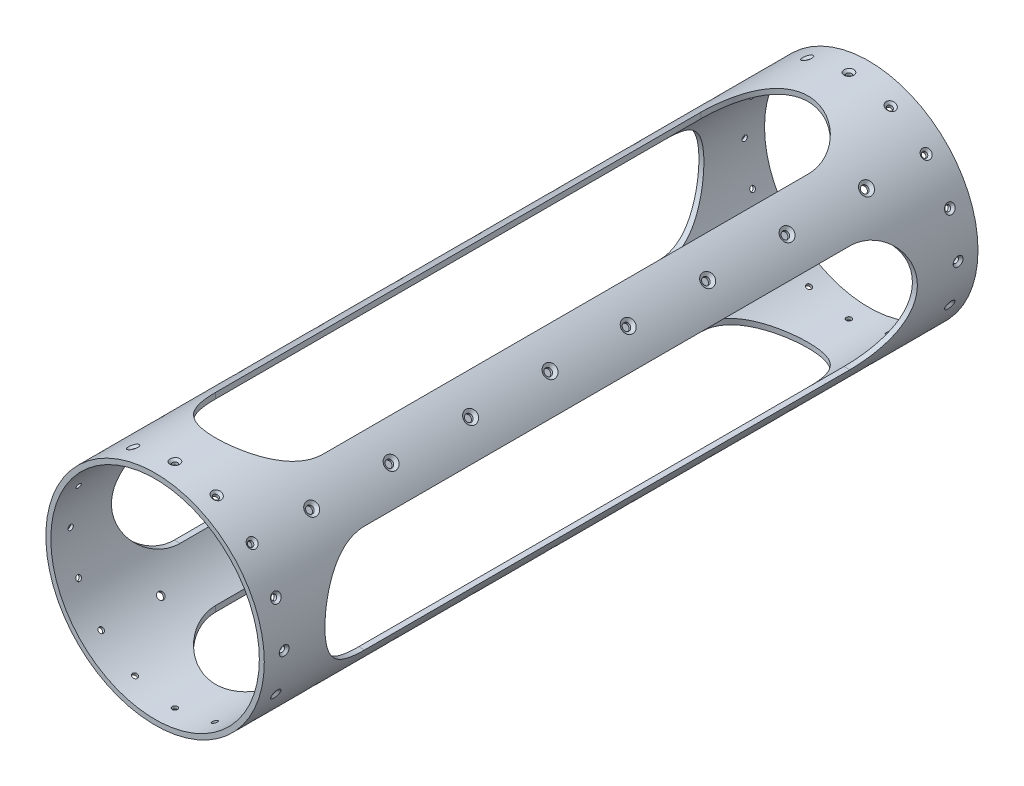
from build123d import *

# Parameters (mm, degrees)
SKETCH1_R                                         = 69.85
SKETCH1_R_2                                       = 66.675
EXTRUDE1_DEPTH                                    = 228.2063
CSK_FOR_M3_FLAT_HEAD_MACHINE_SCREW1_D             = 3.4
CSK_FOR_M3_FLAT_HEAD_MACHINE_SCREW1_CSINK_D       = 6.3
CSK_FOR_M3_FLAT_HEAD_MACHINE_SCREW1_CSINK_ANGLE   = 90
EXTRUDE2_DEPTH                                    = 249.668776557
CIRPATTERN2_COUNT                                 = 4
CIRPATTERN1_COUNT                                 = 16
CSK_FOR_8_FLAT_HEAD_MACHINE_SCREW_100_D           = 4.4958
CSK_FOR_8_FLAT_HEAD_MACHINE_SCREW_100_CSINK_D     = 8.4328
CSK_FOR_8_FLAT_HEAD_MACHINE_SCREW_100_CSINK_ANGLE = 100
LPATTERN1_COUNT                                   = 4
LPATTERN1_PITCH                                   = 50.8
CIRPATTERN3_COUNT                                 = 4
CIRPATTERN3_COPY_1_D                              = 4.4958
CIRPATTERN3_COPY_1_CSINK_D                        = 8.4328
CIRPATTERN3_COPY_1_CSINK_ANGLE                    = 100
CIRPATTERN3_COPY_2_D                              = 4.4958
CIRPATTERN3_COPY_2_CSINK_D                        = 8.4328
CIRPATTERN3_COPY_2_CSINK_ANGLE                    = 100
CIRPATTERN3_COPY_3_D                              = 4.4958
CIRPATTERN3_COPY_3_CSINK_D                        = 8.4328
CIRPATTERN3_COPY_3_CSINK_ANGLE                    = 100
CIRPATTERN3_COPY_4_D                              = 4.4958
CIRPATTERN3_COPY_4_CSINK_D                        = 8.4328
CIRPATTERN3_COPY_4_CSINK_ANGLE                    = 100
CIRPATTERN3_COPY_5_D                              = 4.4958
CIRPATTERN3_COPY_5_CSINK_D                        = 8.4328
CIRPATTERN3_COPY_5_CSINK_ANGLE                    = 100
CIRPATTERN3_COPY_6_D                              = 4.4958
CIRPATTERN3_COPY_6_CSINK_D                        = 8.4328
CIRPATTERN3_COPY_6_CSINK_ANGLE                    = 100
CIRPATTERN3_COPY_7_D                              = 4.4958
CIRPATTERN3_COPY_7_CSINK_D                        = 8.4328
CIRPATTERN3_COPY_7_CSINK_ANGLE                    = 100
CIRPATTERN3_COPY_8_D                              = 4.4958
CIRPATTERN3_COPY_8_CSINK_D                        = 8.4328
CIRPATTERN3_COPY_8_CSINK_ANGLE                    = 100
CIRPATTERN3_COPY_9_D                              = 4.4958
CIRPATTERN3_COPY_9_CSINK_D                        = 8.4328
CIRPATTERN3_COPY_9_CSINK_ANGLE                    = 100
MIRROR1_COPY_1_DEPTH                              = 249.668776557
MIRROR1_COPY_2_DEPTH                              = 249.668776557
MIRROR1_COPY_3_DEPTH                              = 249.668776557
MIRROR1_COPY_4_D                                  = 3.4
MIRROR1_COPY_4_CSINK_D                            = 6.3
MIRROR1_COPY_4_CSINK_ANGLE                        = 90
MIRROR1_COPY_5_D                                  = 3.4
MIRROR1_COPY_5_CSINK_D                            = 6.3
MIRROR1_COPY_5_CSINK_ANGLE                        = 90
MIRROR1_COPY_6_D                                  = 3.4
MIRROR1_COPY_6_CSINK_D                            = 6.3
MIRROR1_COPY_6_CSINK_ANGLE                        = 90
MIRROR1_COPY_7_D                                  = 3.4
MIRROR1_COPY_7_CSINK_D                            = 6.3
MIRROR1_COPY_7_CSINK_ANGLE                        = 90
MIRROR1_COPY_8_D                                  = 3.4
MIRROR1_COPY_8_CSINK_D                            = 6.3
MIRROR1_COPY_8_CSINK_ANGLE                        = 90
MIRROR1_COPY_9_D                                  = 3.4
MIRROR1_COPY_9_CSINK_D                            = 6.3
MIRROR1_COPY_9_CSINK_ANGLE                        = 90
MIRROR1_COPY_10_D                                 = 3.4
MIRROR1_COPY_10_CSINK_D                           = 6.3
MIRROR1_COPY_10_CSINK_ANGLE                       = 90
MIRROR1_COPY_11_D                                 = 3.4
MIRROR1_COPY_11_CSINK_D                           = 6.3
MIRROR1_COPY_11_CSINK_ANGLE                       = 90
MIRROR1_COPY_12_D                                 = 3.4
MIRROR1_COPY_12_CSINK_D                           = 6.3
MIRROR1_COPY_12_CSINK_ANGLE                       = 90
MIRROR1_COPY_13_D                                 = 3.4
MIRROR1_COPY_13_CSINK_D                           = 6.3
MIRROR1_COPY_13_CSINK_ANGLE                       = 90
MIRROR1_COPY_14_D                                 = 3.4
MIRROR1_COPY_14_CSINK_D                           = 6.3
MIRROR1_COPY_14_CSINK_ANGLE                       = 90
MIRROR1_COPY_15_D                                 = 3.4
MIRROR1_COPY_15_CSINK_D                           = 6.3
MIRROR1_COPY_15_CSINK_ANGLE                       = 90
MIRROR1_COPY_16_D                                 = 3.4
MIRROR1_COPY_16_CSINK_D                           = 6.3
MIRROR1_COPY_16_CSINK_ANGLE                       = 90
MIRROR1_COPY_17_D                                 = 3.4
MIRROR1_COPY_17_CSINK_D                           = 6.3
MIRROR1_COPY_17_CSINK_ANGLE                       = 90
MIRROR1_COPY_18_D                                 = 3.4
MIRROR1_COPY_18_CSINK_D                           = 6.3
MIRROR1_COPY_18_CSINK_ANGLE                       = 90
MIRROR1_COPY_19_D                                 = 4.4958
MIRROR1_COPY_19_CSINK_D                           = 8.4328
MIRROR1_COPY_19_CSINK_ANGLE                       = 100
MIRROR1_COPY_20_D                                 = 4.4958
MIRROR1_COPY_20_CSINK_D                           = 8.4328
MIRROR1_COPY_20_CSINK_ANGLE                       = 100
MIRROR1_COPY_21_D                                 = 4.4958
MIRROR1_COPY_21_CSINK_D                           = 8.4328
MIRROR1_COPY_21_CSINK_ANGLE                       = 100
MIRROR1_COPY_22_D                                 = 4.4958
MIRROR1_COPY_22_CSINK_D                           = 8.4328
MIRROR1_COPY_22_CSINK_ANGLE                       = 100
MIRROR1_COPY_23_D                                 = 4.4958
MIRROR1_COPY_23_CSINK_D                           = 8.4328
MIRROR1_COPY_23_CSINK_ANGLE                       = 100
MIRROR1_COPY_24_D                                 = 4.4958
MIRROR1_COPY_24_CSINK_D                           = 8.4328
MIRROR1_COPY_24_CSINK_ANGLE                       = 100
MIRROR1_COPY_25_D                                 = 4.4958
MIRROR1_COPY_25_CSINK_D                           = 8.4328
MIRROR1_COPY_25_CSINK_ANGLE                       = 100
MIRROR1_COPY_26_D                                 = 4.4958
MIRROR1_COPY_26_CSINK_D                           = 8.4328
MIRROR1_COPY_26_CSINK_ANGLE                       = 100
MIRROR1_COPY_27_D                                 = 4.4958
MIRROR1_COPY_27_CSINK_D                           = 8.4328
MIRROR1_COPY_27_CSINK_ANGLE                       = 100
MIRROR1_COPY_28_D                                 = 4.4958
MIRROR1_COPY_28_CSINK_D                           = 8.4328
MIRROR1_COPY_28_CSINK_ANGLE                       = 100
MIRROR1_COPY_29_D                                 = 4.4958
MIRROR1_COPY_29_CSINK_D                           = 8.4328
MIRROR1_COPY_29_CSINK_ANGLE                       = 100
MIRROR1_COPY_30_D                                 = 4.4958
MIRROR1_COPY_30_CSINK_D                           = 8.4328
MIRROR1_COPY_30_CSINK_ANGLE                       = 100
MIRROR1_COPY_31_D                                 = 4.4958
MIRROR1_COPY_31_CSINK_D                           = 8.4328
MIRROR1_COPY_31_CSINK_ANGLE                       = 100
MIRROR1_COPY_32_D                                 = 4.4958
MIRROR1_COPY_32_CSINK_D                           = 8.4328
MIRROR1_COPY_32_CSINK_ANGLE                       = 100
MIRROR1_COPY_33_D                                 = 4.4958
MIRROR1_COPY_33_CSINK_D                           = 8.4328
MIRROR1_COPY_33_CSINK_ANGLE                       = 100


with BuildPart() as part:
    # Sketch1 → Extrude1 (new body)
    with BuildSketch(Plane.XY):
        Circle(SKETCH1_R)
        Circle(SKETCH1_R_2, mode=Mode.SUBTRACT)
    extrude1 = extrude(amount=EXTRUDE1_DEPTH)

    # CSK for M3 Flat Head Machine Screw1 (through all)
    with Locations(Plane(origin=(0, -69.85, 215.5063), x_dir=(1, 0, 0), z_dir=(0, -1, 0))):
        with Locations((0, 0)):
            csk_for_m3_flat_head_machine_screw1 = CounterSinkHole(CSK_FOR_M3_FLAT_HEAD_MACHINE_SCREW1_D / 2, CSK_FOR_M3_FLAT_HEAD_MACHINE_SCREW1_CSINK_D / 2, counter_sink_angle=CSK_FOR_M3_FLAT_HEAD_MACHINE_SCREW1_CSINK_ANGLE)

    # Sketch5 → Extrude2 (cut, symmetric)
    with BuildSketch(Plane(origin=(0, 0, 0), x_dir=(1, 0, 0), z_dir=(0, 1, 0))):
        with BuildLine():
            Line((0, 0), (34.29, 0))
            Line((34.29, 0), (34.29, -155.139189337))
            ThreePointArc((34.29, -155.139189337), (0, -189.429189337), (-34.29, -155.139189337))
            Line((-34.29, -155.139189337), (-34.29, 0))
            Line((-34.29, 0), (0, 0))
        make_face()
    extrude2 = extrude(amount=EXTRUDE2_DEPTH, both=True, mode=Mode.SUBTRACT)

    # CirPattern2: Extrude2 ×4 about axis
    cirpattern2_axis = Axis((0, 0, 228.2063), (0, 0, -1))
    for i in range(1, CIRPATTERN2_COUNT):
        add(extrude2.rotate(cirpattern2_axis, i * 360 / CIRPATTERN2_COUNT), mode=Mode.SUBTRACT)

    # CirPattern1: CSK for M3 Flat Head Machine Screw1 ×16 about axis
    cirpattern1_axis = Axis((0, 0, 228.2063), (0, 0, -1))
    for i in range(1, CIRPATTERN1_COUNT):
        add(csk_for_m3_flat_head_machine_screw1.rotate(cirpattern1_axis, i * 360 / CIRPATTERN1_COUNT), mode=Mode.SUBTRACT)

    # CSK for #8 Flat Head Machine Screw (100)1 (through all)
    with Locations(Plane(origin=(49.391408666, -49.391408666, 114.10315), x_dir=(-0.7071067811865488, -0.7071067811865464, 0), z_dir=(0.7071067811865464, -0.7071067811865488, 0))):
        with Locations((0, -63.30315)):
            csk_for_8_flat_head_machine_screw_100 = CounterSinkHole(CSK_FOR_8_FLAT_HEAD_MACHINE_SCREW_100_D / 2, CSK_FOR_8_FLAT_HEAD_MACHINE_SCREW_100_CSINK_D / 2, counter_sink_angle=CSK_FOR_8_FLAT_HEAD_MACHINE_SCREW_100_CSINK_ANGLE)

    # LPattern1: CSK for #8 Flat Head Machine Screw (100)1 ×4
    with Locations(*[(0, 0, -i * LPATTERN1_PITCH) for i in range(1, LPATTERN1_COUNT)]):
        add(csk_for_8_flat_head_machine_screw_100, mode=Mode.SUBTRACT)

    # CirPattern3: CSK for #8 Flat Head Machine Screw (100)1 ×4 about axis
    cirpattern3_axis = Axis((0, 0, 228.2063), (0, 0, -1))
    for i in range(1, CIRPATTERN3_COUNT):
        add(csk_for_8_flat_head_machine_screw_100.rotate(cirpattern3_axis, i * 360 / CIRPATTERN3_COUNT), mode=Mode.SUBTRACT)

    # CirPattern3 copy 1 (through all)
    with Locations(Plane(origin=(-49.391408666, -49.391408666, 63.30315), x_dir=(-0.7071067811865464, 0.7071067811865488, 0), z_dir=(-0.7071067811865488, -0.7071067811865464, 0))):
        with Locations((0, -63.30315)):
            CounterSinkHole(CIRPATTERN3_COPY_1_D / 2, CIRPATTERN3_COPY_1_CSINK_D / 2, counter_sink_angle=CIRPATTERN3_COPY_1_CSINK_ANGLE)

    # CirPattern3 copy 2 (through all)
    with Locations(Plane(origin=(-49.391408666, 49.391408666, 63.30315), x_dir=(0.7071067811865487, 0.7071067811865465, 0), z_dir=(-0.7071067811865465, 0.7071067811865487, 0))):
        with Locations((0, -63.30315)):
            CounterSinkHole(CIRPATTERN3_COPY_2_D / 2, CIRPATTERN3_COPY_2_CSINK_D / 2, counter_sink_angle=CIRPATTERN3_COPY_2_CSINK_ANGLE)

    # CirPattern3 copy 3 (through all)
    with Locations(Plane(origin=(49.391408666, 49.391408666, 63.30315), x_dir=(0.7071067811865465, -0.7071067811865487, 0), z_dir=(0.7071067811865487, 0.7071067811865465, 0))):
        with Locations((0, -63.30315)):
            CounterSinkHole(CIRPATTERN3_COPY_3_D / 2, CIRPATTERN3_COPY_3_CSINK_D / 2, counter_sink_angle=CIRPATTERN3_COPY_3_CSINK_ANGLE)

    # CirPattern3 copy 4 (through all)
    with Locations(Plane(origin=(-49.391408666, -49.391408666, 12.50315), x_dir=(-0.7071067811865464, 0.7071067811865488, 0), z_dir=(-0.7071067811865488, -0.7071067811865464, 0))):
        with Locations((0, -63.30315)):
            CounterSinkHole(CIRPATTERN3_COPY_4_D / 2, CIRPATTERN3_COPY_4_CSINK_D / 2, counter_sink_angle=CIRPATTERN3_COPY_4_CSINK_ANGLE)

    # CirPattern3 copy 5 (through all)
    with Locations(Plane(origin=(-49.391408666, 49.391408666, 12.50315), x_dir=(0.7071067811865487, 0.7071067811865465, 0), z_dir=(-0.7071067811865465, 0.7071067811865487, 0))):
        with Locations((0, -63.30315)):
            CounterSinkHole(CIRPATTERN3_COPY_5_D / 2, CIRPATTERN3_COPY_5_CSINK_D / 2, counter_sink_angle=CIRPATTERN3_COPY_5_CSINK_ANGLE)

    # CirPattern3 copy 6 (through all)
    with Locations(Plane(origin=(49.391408666, 49.391408666, 12.50315), x_dir=(0.7071067811865465, -0.7071067811865487, 0), z_dir=(0.7071067811865487, 0.7071067811865465, 0))):
        with Locations((0, -63.30315)):
            CounterSinkHole(CIRPATTERN3_COPY_6_D / 2, CIRPATTERN3_COPY_6_CSINK_D / 2, counter_sink_angle=CIRPATTERN3_COPY_6_CSINK_ANGLE)

    # CirPattern3 copy 7 (through all)
    with Locations(Plane(origin=(-49.391408666, -49.391408666, -38.29685), x_dir=(-0.7071067811865464, 0.7071067811865488, 0), z_dir=(-0.7071067811865488, -0.7071067811865464, 0))):
        with Locations((0, -63.30315)):
            CounterSinkHole(CIRPATTERN3_COPY_7_D / 2, CIRPATTERN3_COPY_7_CSINK_D / 2, counter_sink_angle=CIRPATTERN3_COPY_7_CSINK_ANGLE)

    # CirPattern3 copy 8 (through all)
    with Locations(Plane(origin=(-49.391408666, 49.391408666, -38.29685), x_dir=(0.7071067811865487, 0.7071067811865465, 0), z_dir=(-0.7071067811865465, 0.7071067811865487, 0))):
        with Locations((0, -63.30315)):
            CounterSinkHole(CIRPATTERN3_COPY_8_D / 2, CIRPATTERN3_COPY_8_CSINK_D / 2, counter_sink_angle=CIRPATTERN3_COPY_8_CSINK_ANGLE)

    # CirPattern3 copy 9 (through all)
    with Locations(Plane(origin=(49.391408666, 49.391408666, -38.29685), x_dir=(0.7071067811865465, -0.7071067811865487, 0), z_dir=(0.7071067811865487, 0.7071067811865465, 0))):
        with Locations((0, -63.30315)):
            CounterSinkHole(CIRPATTERN3_COPY_9_D / 2, CIRPATTERN3_COPY_9_CSINK_D / 2, counter_sink_angle=CIRPATTERN3_COPY_9_CSINK_ANGLE)

    # Mirror1: Extrude1, CSK for M3 Flat Head Machine Screw1, Extrude2, CSK for #8 Flat Head Machine Screw (100)1 across plane
    add(extrude1.mirror(Plane.XY))
    add(csk_for_m3_flat_head_machine_screw1.mirror(Plane.XY), mode=Mode.SUBTRACT)
    add(extrude2.mirror(Plane.XY), mode=Mode.SUBTRACT)
    add(csk_for_8_flat_head_machine_screw_100.mirror(Plane.XY), mode=Mode.SUBTRACT)

    # Mirror1 copy 1 sketch → Mirror1 copy 1 (cut, symmetric)
    with BuildSketch(Plane(origin=(0, 0, 0), x_dir=(0, -1, 0), z_dir=(1, 0, 0))):
        with BuildLine():
            Line((0, 0), (34.29, 0))
            Line((34.29, 0), (34.29, 155.139189337))
            ThreePointArc((34.29, 155.139189337), (0, 189.429189337), (-34.29, 155.139189337))
            Line((-34.29, 155.139189337), (-34.29, 0))
            Line((-34.29, 0), (0, 0))
        make_face()
    extrude(amount=MIRROR1_COPY_1_DEPTH, both=True, mode=Mode.SUBTRACT)

    # Mirror1 copy 2 sketch → Mirror1 copy 2 (cut, symmetric)
    with BuildSketch(Plane(origin=(0, 0, 0), x_dir=(-1, 0, 0), z_dir=(0, -1, 0))):
        with BuildLine():
            Line((0, 0), (34.29, 0))
            Line((34.29, 0), (34.29, 155.139189337))
            ThreePointArc((34.29, 155.139189337), (0, 189.429189337), (-34.29, 155.139189337))
            Line((-34.29, 155.139189337), (-34.29, 0))
            Line((-34.29, 0), (0, 0))
        make_face()
    extrude(amount=MIRROR1_COPY_2_DEPTH, both=True, mode=Mode.SUBTRACT)

    # Mirror1 copy 3 sketch → Mirror1 copy 3 (cut, symmetric)
    with BuildSketch(Plane(origin=(0, 0, 0), x_dir=(0, 1, 0), z_dir=(-1, 0, 0))):
        with BuildLine():
            Line((0, 0), (34.29, 0))
            Line((34.29, 0), (34.29, 155.139189337))
            ThreePointArc((34.29, 155.139189337), (0, 189.429189337), (-34.29, 155.139189337))
            Line((-34.29, 155.139189337), (-34.29, 0))
            Line((-34.29, 0), (0, 0))
        make_face()
    extrude(amount=MIRROR1_COPY_3_DEPTH, both=True, mode=Mode.SUBTRACT)

    # Mirror1 copy 4 (through all)
    with Locations(Plane(origin=(-26.730437751, -64.532985346, -215.5063), x_dir=(0.9238795325112868, -0.3826834323650896, 0), z_dir=(-0.3826834323650896, -0.9238795325112868, 0))):
        with Locations((0, 0)):
            CounterSinkHole(MIRROR1_COPY_4_D / 2, MIRROR1_COPY_4_CSINK_D / 2, counter_sink_angle=MIRROR1_COPY_4_CSINK_ANGLE)

    # Mirror1 copy 5 (through all)
    with Locations(Plane(origin=(-49.391408666, -49.391408666, -215.5063), x_dir=(0.7071067811865477, -0.7071067811865474, 0), z_dir=(-0.7071067811865474, -0.7071067811865477, 0))):
        with Locations((0, 0)):
            CounterSinkHole(MIRROR1_COPY_5_D / 2, MIRROR1_COPY_5_CSINK_D / 2, counter_sink_angle=MIRROR1_COPY_5_CSINK_ANGLE)

    # Mirror1 copy 6 (through all)
    with Locations(Plane(origin=(-64.532985346, -26.730437751, -215.5063), x_dir=(0.38268343236509, -0.9238795325112866, 0), z_dir=(-0.9238795325112866, -0.38268343236509, 0))):
        with Locations((0, 0)):
            CounterSinkHole(MIRROR1_COPY_6_D / 2, MIRROR1_COPY_6_CSINK_D / 2, counter_sink_angle=MIRROR1_COPY_6_CSINK_ANGLE)

    # Mirror1 copy 7 (through all)
    with Locations(Plane(origin=(-69.85, 0, -215.5063), x_dir=(0, -1, 0), z_dir=(-1, 0, 0))):
        with Locations((0, 0)):
            CounterSinkHole(MIRROR1_COPY_7_D / 2, MIRROR1_COPY_7_CSINK_D / 2, counter_sink_angle=MIRROR1_COPY_7_CSINK_ANGLE)

    # Mirror1 copy 8 (through all)
    with Locations(Plane(origin=(-64.532985346, 26.730437751, -215.5063), x_dir=(-0.38268343236508956, -0.9238795325112868, 0), z_dir=(-0.9238795325112868, 0.38268343236508956, 0))):
        with Locations((0, 0)):
            CounterSinkHole(MIRROR1_COPY_8_D / 2, MIRROR1_COPY_8_CSINK_D / 2, counter_sink_angle=MIRROR1_COPY_8_CSINK_ANGLE)

    # Mirror1 copy 9 (through all)
    with Locations(Plane(origin=(-49.391408666, 49.391408666, -215.5063), x_dir=(-0.7071067811865474, -0.7071067811865477, 0), z_dir=(-0.7071067811865477, 0.7071067811865474, 0))):
        with Locations((0, 0)):
            CounterSinkHole(MIRROR1_COPY_9_D / 2, MIRROR1_COPY_9_CSINK_D / 2, counter_sink_angle=MIRROR1_COPY_9_CSINK_ANGLE)

    # Mirror1 copy 10 (through all)
    with Locations(Plane(origin=(-26.730437751, 64.532985346, -215.5063), x_dir=(-0.9238795325112866, -0.38268343236509006, 0), z_dir=(-0.38268343236509006, 0.9238795325112866, 0))):
        with Locations((0, 0)):
            CounterSinkHole(MIRROR1_COPY_10_D / 2, MIRROR1_COPY_10_CSINK_D / 2, counter_sink_angle=MIRROR1_COPY_10_CSINK_ANGLE)

    # Mirror1 copy 11 (through all)
    with Locations(Plane(origin=(0, 69.85, -215.5063), x_dir=(-1, 0, 0), z_dir=(0, 1, 0))):
        with Locations((0, 0)):
            CounterSinkHole(MIRROR1_COPY_11_D / 2, MIRROR1_COPY_11_CSINK_D / 2, counter_sink_angle=MIRROR1_COPY_11_CSINK_ANGLE)

    # Mirror1 copy 12 (through all)
    with Locations(Plane(origin=(26.730437751, 64.532985346, -215.5063), x_dir=(-0.923879532511287, 0.3826834323650895, 0), z_dir=(0.3826834323650895, 0.923879532511287, 0))):
        with Locations((0, 0)):
            CounterSinkHole(MIRROR1_COPY_12_D / 2, MIRROR1_COPY_12_CSINK_D / 2, counter_sink_angle=MIRROR1_COPY_12_CSINK_ANGLE)

    # Mirror1 copy 13 (through all)
    with Locations(Plane(origin=(49.391408666, 49.391408666, -215.5063), x_dir=(-0.7071067811865478, 0.7071067811865474, 0), z_dir=(0.7071067811865474, 0.7071067811865478, 0))):
        with Locations((0, 0)):
            CounterSinkHole(MIRROR1_COPY_13_D / 2, MIRROR1_COPY_13_CSINK_D / 2, counter_sink_angle=MIRROR1_COPY_13_CSINK_ANGLE)

    # Mirror1 copy 14 (through all)
    with Locations(Plane(origin=(64.532985346, 26.730437751, -215.5063), x_dir=(-0.38268343236508967, 0.9238795325112867, 0), z_dir=(0.9238795325112867, 0.38268343236508967, 0))):
        with Locations((0, 0)):
            CounterSinkHole(MIRROR1_COPY_14_D / 2, MIRROR1_COPY_14_CSINK_D / 2, counter_sink_angle=MIRROR1_COPY_14_CSINK_ANGLE)

    # Mirror1 copy 15 (through all)
    with Locations(Plane(origin=(69.85, 0, -215.5063), x_dir=(0, 1, 0), z_dir=(1, 0, 0))):
        with Locations((0, 0)):
            CounterSinkHole(MIRROR1_COPY_15_D / 2, MIRROR1_COPY_15_CSINK_D / 2, counter_sink_angle=MIRROR1_COPY_15_CSINK_ANGLE)

    # Mirror1 copy 16 (through all)
    with Locations(Plane(origin=(64.532985346, -26.730437751, -215.5063), x_dir=(0.38268343236508984, 0.9238795325112867, 0), z_dir=(0.9238795325112867, -0.38268343236508984, 0))):
        with Locations((0, 0)):
            CounterSinkHole(MIRROR1_COPY_16_D / 2, MIRROR1_COPY_16_CSINK_D / 2, counter_sink_angle=MIRROR1_COPY_16_CSINK_ANGLE)

    # Mirror1 copy 17 (through all)
    with Locations(Plane(origin=(49.391408666, -49.391408666, -215.5063), x_dir=(0.7071067811865472, 0.7071067811865478, 0), z_dir=(0.7071067811865478, -0.7071067811865472, 0))):
        with Locations((0, 0)):
            CounterSinkHole(MIRROR1_COPY_17_D / 2, MIRROR1_COPY_17_CSINK_D / 2, counter_sink_angle=MIRROR1_COPY_17_CSINK_ANGLE)

    # Mirror1 copy 18 (through all)
    with Locations(Plane(origin=(26.730437751, -64.532985346, -215.5063), x_dir=(0.9238795325112867, 0.3826834323650897, 0), z_dir=(0.3826834323650897, -0.9238795325112867, 0))):
        with Locations((0, 0)):
            CounterSinkHole(MIRROR1_COPY_18_D / 2, MIRROR1_COPY_18_CSINK_D / 2, counter_sink_angle=MIRROR1_COPY_18_CSINK_ANGLE)

    # Mirror1 copy 19 (through all)
    with Locations(Plane(origin=(49.391408666, -49.391408666, -63.30315), x_dir=(-0.7071067811865488, -0.7071067811865464, 0), z_dir=(0.7071067811865464, -0.7071067811865488, 0))):
        with Locations((0, 63.30315)):
            CounterSinkHole(MIRROR1_COPY_19_D / 2, MIRROR1_COPY_19_CSINK_D / 2, counter_sink_angle=MIRROR1_COPY_19_CSINK_ANGLE)

    # Mirror1 copy 20 (through all)
    with Locations(Plane(origin=(49.391408666, -49.391408666, -12.50315), x_dir=(-0.7071067811865488, -0.7071067811865464, 0), z_dir=(0.7071067811865464, -0.7071067811865488, 0))):
        with Locations((0, 63.30315)):
            CounterSinkHole(MIRROR1_COPY_20_D / 2, MIRROR1_COPY_20_CSINK_D / 2, counter_sink_angle=MIRROR1_COPY_20_CSINK_ANGLE)

    # Mirror1 copy 21 (through all)
    with Locations(Plane(origin=(49.391408666, -49.391408666, 38.29685), x_dir=(-0.7071067811865488, -0.7071067811865464, 0), z_dir=(0.7071067811865464, -0.7071067811865488, 0))):
        with Locations((0, 63.30315)):
            CounterSinkHole(MIRROR1_COPY_21_D / 2, MIRROR1_COPY_21_CSINK_D / 2, counter_sink_angle=MIRROR1_COPY_21_CSINK_ANGLE)

    # Mirror1 copy 22 (through all)
    with Locations(Plane(origin=(-49.391408666, -49.391408666, -114.10315), x_dir=(-0.7071067811865464, 0.7071067811865488, 0), z_dir=(-0.7071067811865488, -0.7071067811865464, 0))):
        with Locations((0, 63.30315)):
            CounterSinkHole(MIRROR1_COPY_22_D / 2, MIRROR1_COPY_22_CSINK_D / 2, counter_sink_angle=MIRROR1_COPY_22_CSINK_ANGLE)

    # Mirror1 copy 23 (through all)
    with Locations(Plane(origin=(-49.391408666, 49.391408666, -114.10315), x_dir=(0.7071067811865487, 0.7071067811865465, 0), z_dir=(-0.7071067811865465, 0.7071067811865487, 0))):
        with Locations((0, 63.30315)):
            CounterSinkHole(MIRROR1_COPY_23_D / 2, MIRROR1_COPY_23_CSINK_D / 2, counter_sink_angle=MIRROR1_COPY_23_CSINK_ANGLE)

    # Mirror1 copy 24 (through all)
    with Locations(Plane(origin=(49.391408666, 49.391408666, -114.10315), x_dir=(0.7071067811865465, -0.7071067811865487, 0), z_dir=(0.7071067811865487, 0.7071067811865465, 0))):
        with Locations((0, 63.30315)):
            CounterSinkHole(MIRROR1_COPY_24_D / 2, MIRROR1_COPY_24_CSINK_D / 2, counter_sink_angle=MIRROR1_COPY_24_CSINK_ANGLE)

    # Mirror1 copy 25 (through all)
    with Locations(Plane(origin=(-49.391408666, -49.391408666, -63.30315), x_dir=(-0.7071067811865464, 0.7071067811865488, 0), z_dir=(-0.7071067811865488, -0.7071067811865464, 0))):
        with Locations((0, 63.30315)):
            CounterSinkHole(MIRROR1_COPY_25_D / 2, MIRROR1_COPY_25_CSINK_D / 2, counter_sink_angle=MIRROR1_COPY_25_CSINK_ANGLE)

    # Mirror1 copy 26 (through all)
    with Locations(Plane(origin=(-49.391408666, 49.391408666, -63.30315), x_dir=(0.7071067811865487, 0.7071067811865465, 0), z_dir=(-0.7071067811865465, 0.7071067811865487, 0))):
        with Locations((0, 63.30315)):
            CounterSinkHole(MIRROR1_COPY_26_D / 2, MIRROR1_COPY_26_CSINK_D / 2, counter_sink_angle=MIRROR1_COPY_26_CSINK_ANGLE)

    # Mirror1 copy 27 (through all)
    with Locations(Plane(origin=(49.391408666, 49.391408666, -63.30315), x_dir=(0.7071067811865465, -0.7071067811865487, 0), z_dir=(0.7071067811865487, 0.7071067811865465, 0))):
        with Locations((0, 63.30315)):
            CounterSinkHole(MIRROR1_COPY_27_D / 2, MIRROR1_COPY_27_CSINK_D / 2, counter_sink_angle=MIRROR1_COPY_27_CSINK_ANGLE)

    # Mirror1 copy 28 (through all)
    with Locations(Plane(origin=(-49.391408666, -49.391408666, -12.50315), x_dir=(-0.7071067811865464, 0.7071067811865488, 0), z_dir=(-0.7071067811865488, -0.7071067811865464, 0))):
        with Locations((0, 63.30315)):
            CounterSinkHole(MIRROR1_COPY_28_D / 2, MIRROR1_COPY_28_CSINK_D / 2, counter_sink_angle=MIRROR1_COPY_28_CSINK_ANGLE)

    # Mirror1 copy 29 (through all)
    with Locations(Plane(origin=(-49.391408666, 49.391408666, -12.50315), x_dir=(0.7071067811865487, 0.7071067811865465, 0), z_dir=(-0.7071067811865465, 0.7071067811865487, 0))):
        with Locations((0, 63.30315)):
            CounterSinkHole(MIRROR1_COPY_29_D / 2, MIRROR1_COPY_29_CSINK_D / 2, counter_sink_angle=MIRROR1_COPY_29_CSINK_ANGLE)

    # Mirror1 copy 30 (through all)
    with Locations(Plane(origin=(49.391408666, 49.391408666, -12.50315), x_dir=(0.7071067811865465, -0.7071067811865487, 0), z_dir=(0.7071067811865487, 0.7071067811865465, 0))):
        with Locations((0, 63.30315)):
            CounterSinkHole(MIRROR1_COPY_30_D / 2, MIRROR1_COPY_30_CSINK_D / 2, counter_sink_angle=MIRROR1_COPY_30_CSINK_ANGLE)

    # Mirror1 copy 31 (through all)
    with Locations(Plane(origin=(-49.391408666, -49.391408666, 38.29685), x_dir=(-0.7071067811865464, 0.7071067811865488, 0), z_dir=(-0.7071067811865488, -0.7071067811865464, 0))):
        with Locations((0, 63.30315)):
            CounterSinkHole(MIRROR1_COPY_31_D / 2, MIRROR1_COPY_31_CSINK_D / 2, counter_sink_angle=MIRROR1_COPY_31_CSINK_ANGLE)

    # Mirror1 copy 32 (through all)
    with Locations(Plane(origin=(-49.391408666, 49.391408666, 38.29685), x_dir=(0.7071067811865487, 0.7071067811865465, 0), z_dir=(-0.7071067811865465, 0.7071067811865487, 0))):
        with Locations((0, 63.30315)):
            CounterSinkHole(MIRROR1_COPY_32_D / 2, MIRROR1_COPY_32_CSINK_D / 2, counter_sink_angle=MIRROR1_COPY_32_CSINK_ANGLE)

    # Mirror1 copy 33 (through all)
    with Locations(Plane(origin=(49.391408666, 49.391408666, 38.29685), x_dir=(0.7071067811865465, -0.7071067811865487, 0), z_dir=(0.7071067811865487, 0.7071067811865465, 0))):
        with Locations((0, 63.30315)):
            CounterSinkHole(MIRROR1_COPY_33_D / 2, MIRROR1_COPY_33_CSINK_D / 2, counter_sink_angle=MIRROR1_COPY_33_CSINK_ANGLE)


solid = part.part
